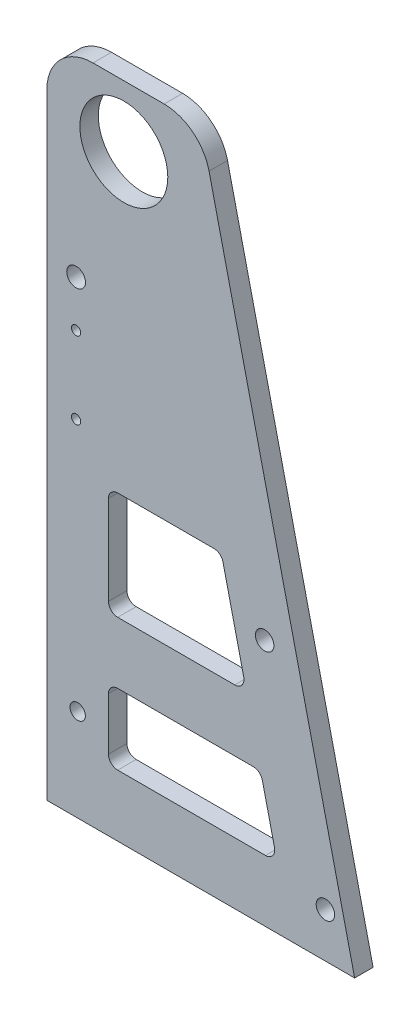
from build123d import *

# Parameters (mm, degrees)
ESBO_O1_R                = 14.2875
ESBO_O1_R_2              = 2.5
RESSALTO_EXTRUS_O2_DEPTH = 6
FILETE1_R                = 15
ESBO_O3_R                = 1.5
ESBO_O3_R_2              = 3
ESBO_O3_R_3              = 3.05
CORTE_EXTRUS_O1_DEPTH    = 238.194013415
ESBO_O5_R                = 3
CORTE_EXTRUS_O2_DEPTH    = 238.194013415


with BuildPart() as part:
    # Esboço1 → Ressalto-extrusão2 (new body)
    with BuildSketch(Plane.XY):
        Polygon((0, 0), (0, 215), (50, 215), (100, 0), align=None)
        with Locations((25, 195)):
            Circle(ESBO_O1_R, mode=Mode.SUBTRACT)
        with Locations((10, 30)):
            Circle(ESBO_O1_R_2, mode=Mode.SUBTRACT)
        with BuildLine():
            Line((20, 95), (20, 66))
            ThreePointArc((20, 66), (20.878679656, 63.878679656), (23, 63))
            Line((23, 63), (61.03739436, 63))
            ThreePointArc((61.03739436, 63), (63.386715693, 64.134339454), (63.959418441, 66.679540484))
            Line((63.959418441, 66.679540484), (57.215232395, 95.679540484))
            ThreePointArc((57.215232395, 95.679540484), (56.15886886, 97.349321333), (54.293208314, 98))
            Line((54.293208314, 98), (23, 98))
            ThreePointArc((23, 98), (20.878679656, 97.121320344), (20, 95))
        make_face(mode=Mode.SUBTRACT)
        with BuildLine():
            Line((20, 40), (20, 23))
            ThreePointArc((20, 23), (20.878679656, 20.878679656), (23, 20))
            Line((23, 20), (71.03739436, 20))
            ThreePointArc((71.03739436, 20), (73.386715693, 21.134339454), (73.959418441, 23.679540484))
            Line((73.959418441, 23.679540484), (70.005930069, 40.679540484))
            ThreePointArc((70.005930069, 40.679540484), (68.949566534, 42.349321333), (67.083905988, 43))
            Line((67.083905988, 43), (23, 43))
            ThreePointArc((23, 43), (20.878679656, 42.121320344), (20, 40))
        make_face(mode=Mode.SUBTRACT)
    extrude(amount=RESSALTO_EXTRUS_O2_DEPTH)

    # Filete1
    filete1_edges = [part.edges().sort_by_distance(p)[0] for p in [
        (0, 215, 3),
        (50, 215, 3),
    ]]
    fillet(filete1_edges, radius=FILETE1_R)

    # Esboço3 → Corte-extrusão1 (cut, through all)
    with BuildSketch(Plane(origin=(0, 0, 0), x_dir=(-1, 0, 0), z_dir=(0, 0, -1))):
        with Locations((-9.5, 112)):
            Circle(ESBO_O3_R)
        with Locations((-90.5, 14.5)):
            Circle(ESBO_O3_R_2)
        with Locations((-9.5, 137)):
            Circle(ESBO_O3_R)
        with Locations((-9.5, 152)):
            Circle(ESBO_O3_R_3)
    extrude(amount=-CORTE_EXTRUS_O1_DEPTH, mode=Mode.SUBTRACT)

    # Esboço5 → Corte-extrusão2 (cut, through all)
    with BuildSketch(Plane(origin=(0, 0, 0), x_dir=(-1, 0, 0), z_dir=(0, 0, -1))):
        with Locations((-70.759810426, 80.398555206)):
            Circle(ESBO_O5_R)
    extrude(amount=-CORTE_EXTRUS_O2_DEPTH, mode=Mode.SUBTRACT)


solid = part.part
